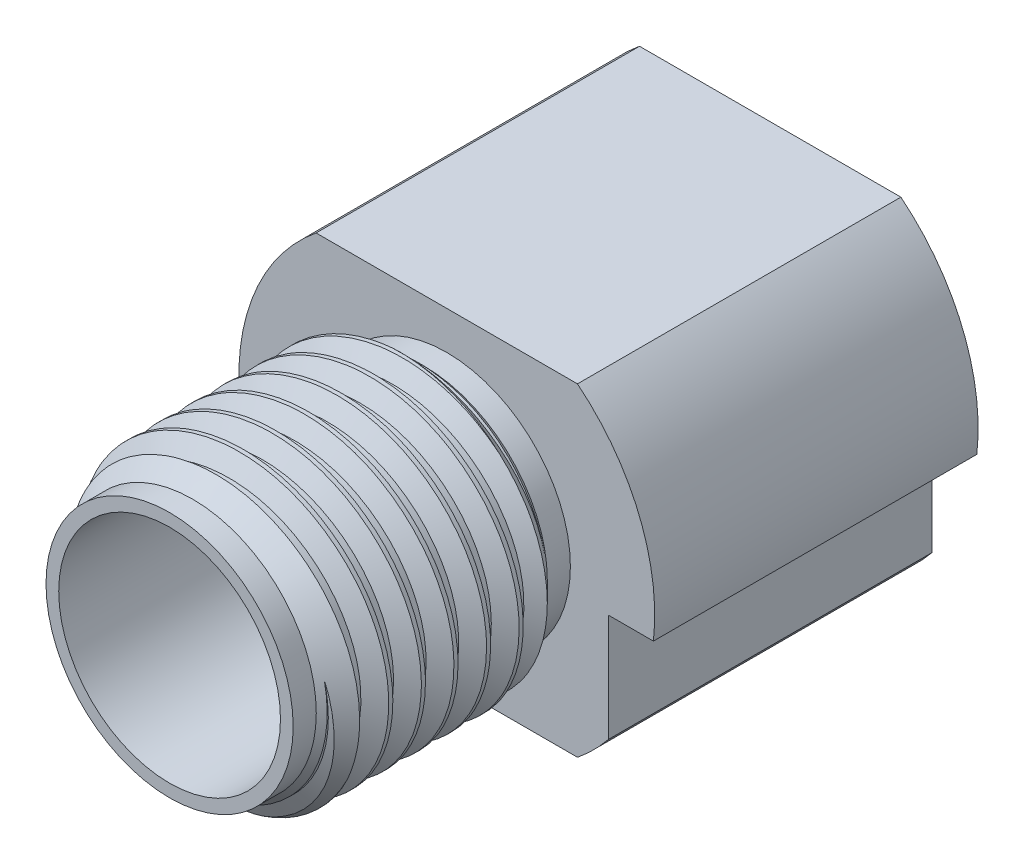
from build123d import *

# Parameters (mm, degrees)
BOSS_EXTRUDE1_DEPTH = 7
SKETCH2_R           = 1.85
CUT_EXTRUDE1_DEPTH  = 0.05
SKETCH3_R           = 0.38
BOSS_EXTRUDE2_DEPTH = 2
CHAMFER1_SIZE       = 0.1
SKETCH4_R           = 2.675
SKETCH4_R_2         = 2.4
BOSS_EXTRUDE3_DEPTH = 6
THREAD1_PITCH       = 0.705555556


with BuildPart() as part:
    # Sketch1 → Boss-Extrude1 (new body)
    with BuildSketch(Plane.XY):
        with BuildLine():
            Line((-2.828427125, 3.5), (2.828427125, 3.5))
            ThreePointArc((2.828427125, 3.5), (4.16227766, 1.710393136), (4.472135955, -0.5))
            Line((4.472135955, -0.5), (3.5, -0.5))
            Line((3.5, -0.5), (3.5, -2.828427125))
            ThreePointArc((3.5, -2.828427125), (3.181980515, -3.181980515), (2.828427125, -3.5))
            Line((2.828427125, -3.5), (-2.828427125, -3.5))
            ThreePointArc((-2.828427125, -3.5), (-3.181980515, -3.181980515), (-3.5, -2.828427125))
            Line((-3.5, -2.828427125), (-3.5, -0.5))
            Line((-3.5, -0.5), (-4.472135955, -0.5))
            ThreePointArc((-4.472135955, -0.5), (-4.16227766, 1.710393136), (-2.828427125, 3.5))
        make_face()
    extrude(amount=BOSS_EXTRUDE1_DEPTH)

    # Sketch2 → Cut-Extrude1 (cut)
    with BuildSketch(Plane(origin=(0, 0, 0), x_dir=(-1, 0, 0), z_dir=(0, 0, -1))):
        Circle(SKETCH2_R)
    extrude(amount=-CUT_EXTRUDE1_DEPTH, mode=Mode.SUBTRACT)

    # Sketch3 → Boss-Extrude2 (add)
    with BuildSketch(Plane(origin=(0, 0, 0.05), x_dir=(-1, 0, 0), z_dir=(0, 0, -1))):
        Circle(SKETCH3_R)
    extrude(amount=BOSS_EXTRUDE2_DEPTH)

    # Chamfer1
    chamfer1_edges = [part.edges().sort_by_distance(p)[0] for p in [
        (0.38, 0, -1.95),
    ]]
    chamfer(chamfer1_edges, length=CHAMFER1_SIZE)

    # Sketch4 → Boss-Extrude3 (add)
    with BuildSketch(Plane.XY.offset(7)):
        Circle(SKETCH4_R)
        Circle(SKETCH4_R_2, mode=Mode.SUBTRACT)
    extrude(amount=BOSS_EXTRUDE3_DEPTH)

    # Sketch10 → Revolve1 (revolve)
    with BuildSketch(Plane(origin=(0, 0, 0), x_dir=(0, 0, -1), z_dir=(1, 0, 0)), mode=Mode.PRIVATE) as revolve1_sk:
        Polygon((-12.5, 2.675), (-12, 3.175), (-8, 3.175), (-7.5, 2.675), align=None)
    revolve(revolve1_sk.sketch.rotate(Axis((0, 0, 13), (0, 0, -1)), 90), axis=Axis((0, 0, 13), (0, 0, -1)))

    # Thread1: the profile of Thread Profile2 profile screwed along a right-hand helix of 14.173228 turns, 6 arcs to a turn; built about Z, then put on its axis
    thread1_z = Axis((0, 0, 0), (0, 0, 1))
    thread1_corners = [(3.1753, 0, -0.000173205), (3.1753, 0, 0.617534314), (2.793106855, 0, 0.396874999), (2.793106855, 0, 0.22048611)]
    with BuildLine(mode=Mode.PRIVATE) as thread1_profile:
        Line(thread1_corners[0], thread1_corners[1])
        Line(thread1_corners[1], thread1_corners[2])
        Line(thread1_corners[2], thread1_corners[3])
        Line(thread1_corners[3], thread1_corners[0])
    thread1_cap = Face(thread1_profile.wire())
    thread1_turn_angles = [0, 30, 60, 90, 120, 150, 180, 210, 240, 270, 300, 330, 360]
    thread1_turn_weights = [1, 0.8660254037844387, 1, 0.8660254037844387, 1, 0.8660254037844387, 1, 0.8660254037844387, 1, 0.8660254037844387, 1, 0.8660254037844387, 1]
    thread1_turn_rails = [Edge.make_bspline([Vector(p[0], p[1], 0).rotate(thread1_z, thread1_turn_angles[k]) / thread1_turn_weights[k] + Vector(0, 0, p[2] + THREAD1_PITCH * thread1_turn_angles[k] / 360) for k in range(13)], [0, 0, 0, 1, 1, 2, 2, 3, 3, 4, 4, 5, 5, 6, 6, 6], 2, thread1_turn_weights) for p in thread1_corners]
    thread1_turn_sides = [Face.make_surface_from_curves(thread1_turn_rails[p[0]], thread1_turn_rails[p[1]]) for p in [(0, 1), (1, 2), (2, 3), (3, 0)]]
    thread1_last_angles = [5040, 5070, 5100, 5101.181102362, 5102.362204724]
    thread1_last_weights = [1, 0.8660254037844387, 1, 0.9997875364486429, 1]
    thread1_last_rails = [Edge.make_bspline([Vector(p[0], p[1], 0).rotate(thread1_z, thread1_last_angles[k]) / thread1_last_weights[k] + Vector(0, 0, p[2] + THREAD1_PITCH * thread1_last_angles[k] / 360) for k in range(5)], [0, 0, 0, 1, 1, 2, 2, 2], 2, thread1_last_weights) for p in thread1_corners]
    thread1_last_sides = [Face.make_surface_from_curves(thread1_last_rails[p[0]], thread1_last_rails[p[1]]) for p in [(0, 1), (1, 2), (2, 3), (3, 0)]]
    thread1 = Plane(origin=(0, 0, 7.2), x_dir=(1, 0, 0), z_dir=(0, 0, 1)) * Solid(Shell([*[p.moved(Location((0, 0, THREAD1_PITCH * i))) for i in range(14) for p in thread1_turn_sides], *thread1_last_sides, thread1_cap, thread1_cap.rotate(thread1_z, 5102.362204724).moved(Location((0, 0, THREAD1_PITCH * 5102.362204724 / 360)))]))
    add(thread1, mode=Mode.SUBTRACT)


solid = part.part
